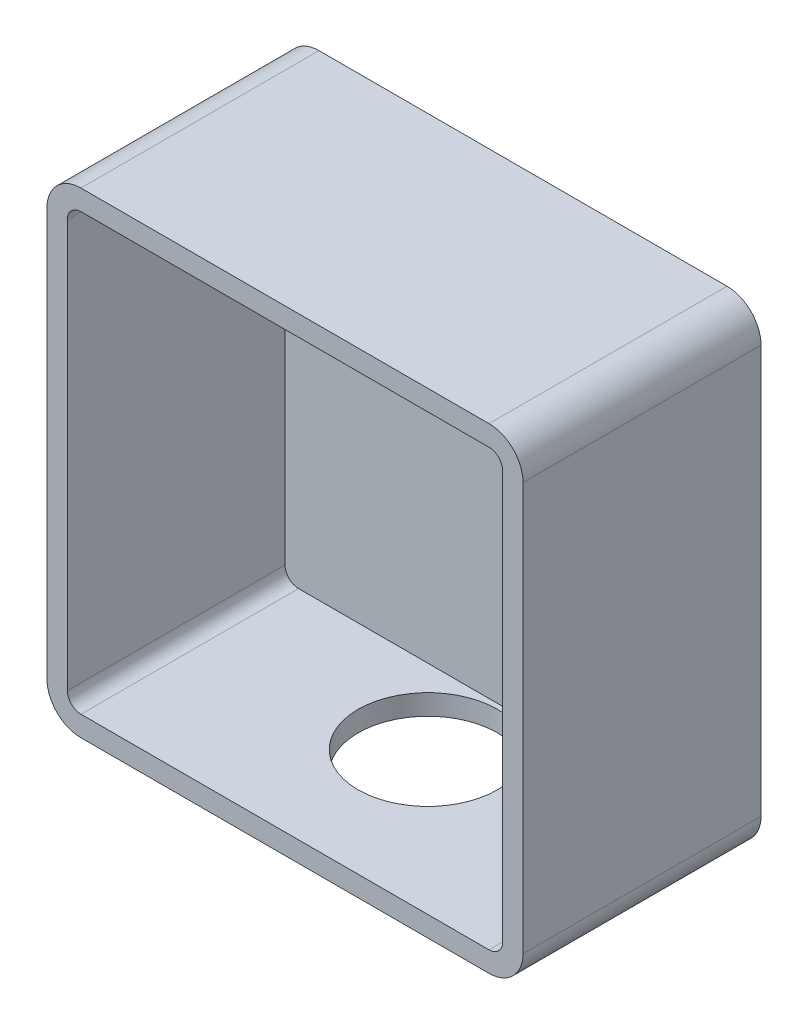
from build123d import *

# Parameters (mm, degrees)
AUFSATZ_LINEAR_AUSTRAGEN1_DEPTH = 35
WANDUNG1_T                      = -3
SCHNITT_LINEAR_AUSTRAGEN1_REACH = 87.732
SKIZZE2_R                       = 10.25


with BuildPart() as part:
    # Skizze1 → Aufsatz-Linear austragen1 (new body)
    with BuildSketch(Plane.XY):
        with BuildLine():
            Line((-30, -35), (30, -35))
            ThreePointArc((30, -35), (33.535533906, -33.535533906), (35, -30))
            Line((35, -30), (35, 30))
            ThreePointArc((35, 30), (33.535533906, 33.535533906), (30, 35))
            Line((30, 35), (-30, 35))
            ThreePointArc((-30, 35), (-33.535533906, 33.535533906), (-35, 30))
            Line((-35, 30), (-35, -30))
            ThreePointArc((-35, -30), (-33.535533906, -33.535533906), (-30, -35))
        make_face()
    extrude(amount=AUFSATZ_LINEAR_AUSTRAGEN1_DEPTH)

    # Wandung1
    wandung1_openings = [part.faces().sort_by_distance(p)[0] for p in [
        (0, 0, 35),
    ]]
    offset(amount=WANDUNG1_T, openings=wandung1_openings, kind=Kind.INTERSECTION)

    # Skizze2 → Schnitt-Linear austragen1 (cut, up to next)
    with BuildSketch(Plane.XZ.offset(35), mode=Mode.PRIVATE) as schnitt_linear_austragen1_sk1:
        with Locations((0, 14)):
            Circle(SKIZZE2_R)
    schnitt_linear_austragen1_tool1 = extrude(schnitt_linear_austragen1_sk1.sketch, amount=-SCHNITT_LINEAR_AUSTRAGEN1_REACH, mode=Mode.PRIVATE) & part.part
    add(schnitt_linear_austragen1_tool1.solids().sort_by_distance((0, -35, 14))[0], mode=Mode.SUBTRACT)


solid = part.part
